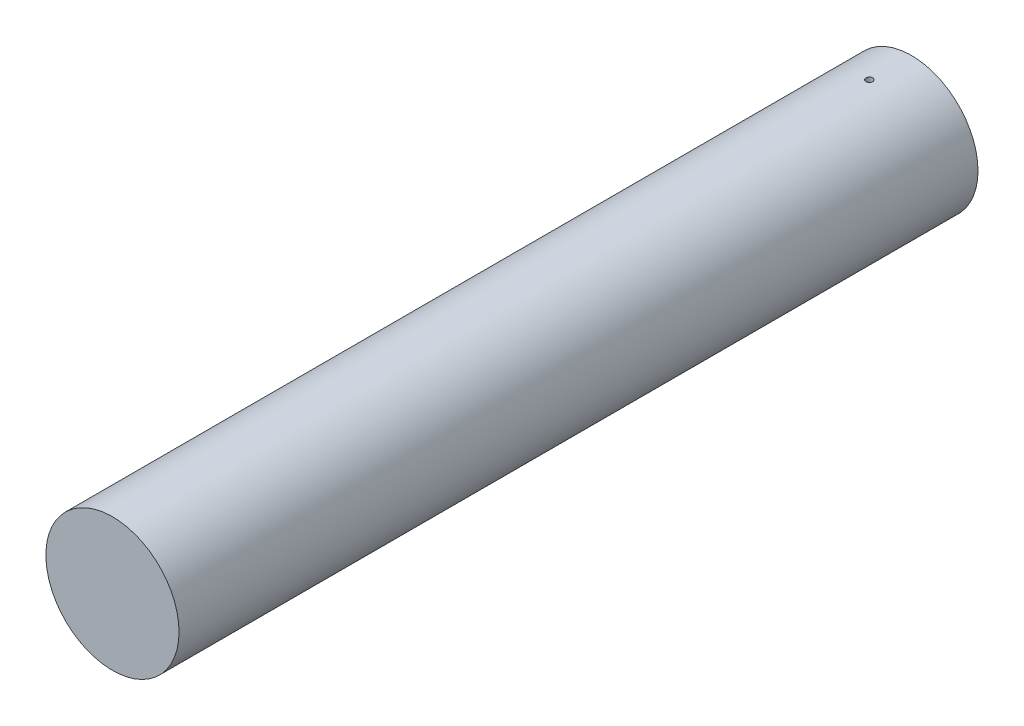
from build123d import *

# Parameters (mm, degrees)
SCHIZZO1_R                    = 100
ESTRUSIONE_ESTRUSIONE1_DEPTH  = 1200
TAGLIO_ESTRUSIONE1_DEPTH      = 1209.304597359
TAGLIO_ESTRUSIONE1_DEPTH_BACK = 1209.304597359
SCHIZZO2_R                    = 5


with BuildPart() as part:
    # Schizzo1 → Estrusione-Estrusione1 (new body)
    with BuildSketch(Plane.XY):
        Circle(SCHIZZO1_R)
    extrude(amount=ESTRUSIONE_ESTRUSIONE1_DEPTH)

    # Schizzo2 → Taglio-Estrusione1 (cut, two sides: drawn at the far end of the back side and taken through both)
    with BuildSketch(Plane(origin=(0, 0, 0), x_dir=(1, 0, 0), z_dir=(0, 1, 0)).offset(-TAGLIO_ESTRUSIONE1_DEPTH_BACK)):
        with Locations((0, -63.218736168)):
            Circle(SCHIZZO2_R)
    extrude(amount=TAGLIO_ESTRUSIONE1_DEPTH + TAGLIO_ESTRUSIONE1_DEPTH_BACK, mode=Mode.SUBTRACT)


solid = part.part
